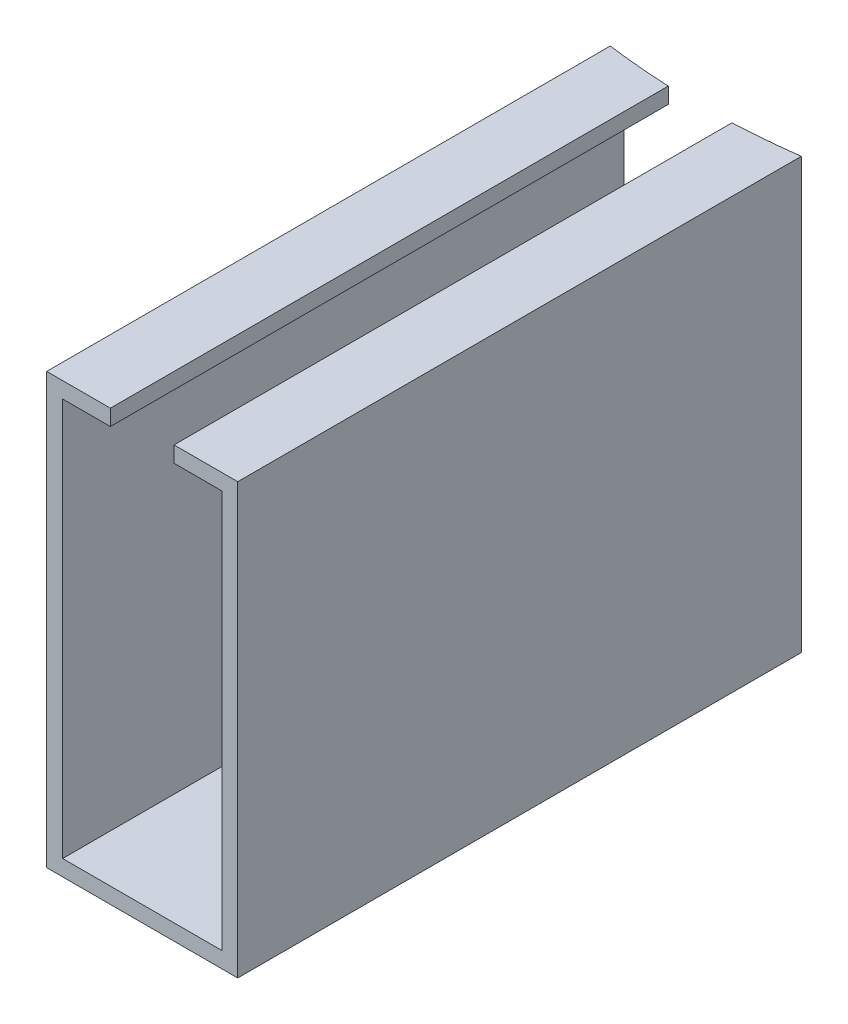
from build123d import *

# Parameters (mm, degrees)
EXTRUDE_1_DEPTH     = 40
SKETCH_2_R          = 22.5
CUT_EXTRUDE_1_DEPTH = 40


with BuildPart() as part:
    # ｽｹｯﾁ1 → ﾎﾞｽ - 押し出し1 (new body)
    with BuildSketch(Plane.XY):
        Polygon((0, 0), (5, 0), (5, 12.5), (3.5, 12.5), (3.5, 13), (5.5, 13), (5.5, 12.5), (5.5, -0.5), (-0.5, -0.5), (-0.5, 12.5), (-0.5, 13), (1.5, 13), (1.5, 12.5), (0, 12.5), align=None)
    extrude(amount=EXTRUDE_1_DEPTH)

    # ｽｹｯﾁ2 → ｶｯﾄ - 押し出し1 (cut)
    with BuildSketch(Plane.XZ.offset(0.5)):
        with Locations((2.5, 0)):
            Circle(SKETCH_2_R)
    extrude(amount=-CUT_EXTRUDE_1_DEPTH, mode=Mode.SUBTRACT)


solid = part.part
